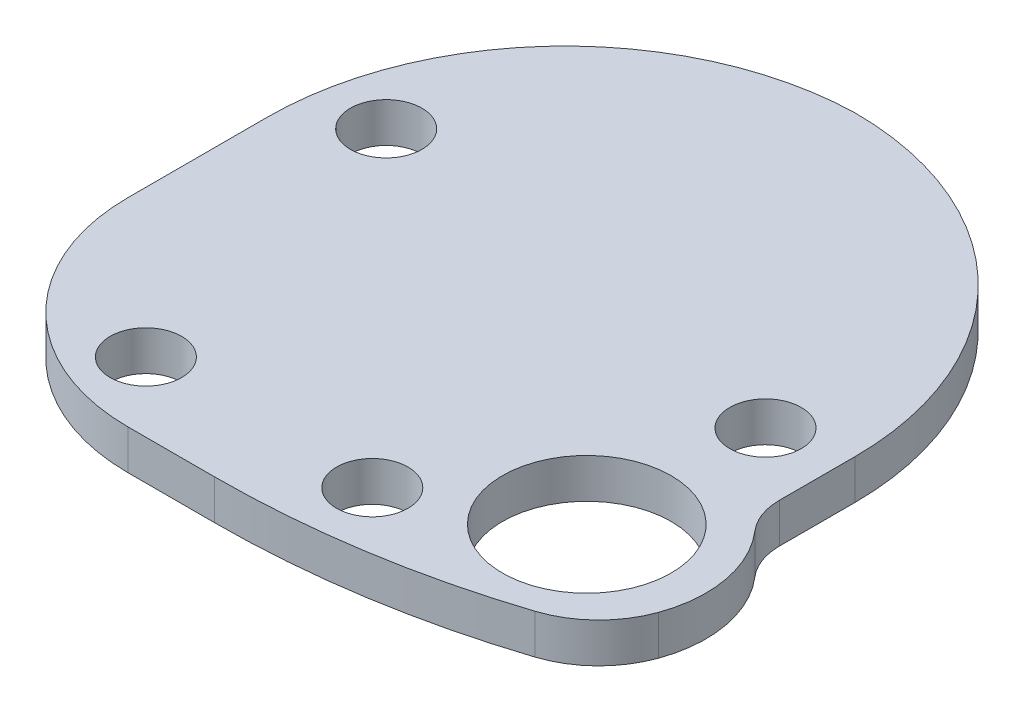
from build123d import *
from build123d.topology import SkipClean

# Parameters (mm, degrees)
SZKIC1_W                    = 15.6
SZKIC1_H                    = 25
SZKIC1_R                    = 1.8
SZKIC1_R_2                  = 1.5
DODANIE_WYCI_GNI_CIE1_DEPTH = 3
DODANIE_WYCI_GNI_CIE2_START = -10.5
SZKIC1_3_R                  = 1.8
SZKIC1_3_R_2                = 1.5
DODANIE_WYCI_GNI_CIE2_DEPTH = 10.5
ZAOKR_GLENIE1_R             = 10
ZAOKR_GLENIE6_R             = 45
ZAOKR_GLENIE7_R             = 5
ZAOKR_GLENIE8_R             = 15
ZAOKR_GLENIE10_R            = 0.2
SZKIC5_R                    = 4.25
WYTNIJ_WYCI_GNI_CIE3_DEPTH  = 1
ZAOKR_GLENIE11_R            = 1
ZAOKR_GLENIE12_START        = -10.5
ZAOKR_GLENIE12_DEPTH        = 13.5
ZAOKR_GLENIE13_R            = 3
DODANIE_WYCI_GNI_CIE3_START = 4.3
SZKIC8_R                    = 1.5
DODANIE_WYCI_GNI_CIE3_DEPTH = 4.3
WYTNIJ_WYCI_GNI_CIE5_DEPTH  = 129.982518339
SZKIC10_R                   = 3.3
WYTNIJ_WYCI_GNI_CIE6_DEPTH  = 1.6
SZKIC11_R                   = 1.8
DODANIE_WYCI_GNI_CIE4_DEPTH = 0.2
SZKIC12_R                   = 1.5
SZKIC12_R_2                 = 1.8
SZKIC12_R_3                 = 3.3
DODANIE_WYCI_GNI_CIE5_DEPTH = 0.2
ZAOKR_GLENIE14_R            = 3
SZKIC13_R                   = 1.5
SZKIC13_R_2                 = 4.25
DODANIE_WYCI_GNI_CIE6_DEPTH = 2
WYTNIJ_WYCI_GNI_CIE7_START  = -19.8
WYTNIJ_WYCI_GNI_CIE7_DEPTH  = 17.8
SZKIC15_R                   = 1.8
WYTNIJ_WYCI_GNI_CIE8_DEPTH  = 128.764040324


with BuildPart() as part:
    # Szkic1 → Dodanie-wyciągnięcie1 (new body)
    # profile 1 of 2: a face of its own
    with BuildSketch(Plane(origin=(0, 0, 0), x_dir=(1, 0, 0), z_dir=(0, 1, 0))):
        with Locations((4, -97.8)):
            Rectangle(SZKIC1_W, SZKIC1_H)
        with Locations(Location((4, -105.3, 0), (0, 0, 270))):
            Circle(SZKIC1_R, mode=Mode.SUBTRACT)
        with Locations(Location((4, -90.3, 0), (0, 0, 270))):
            Circle(SZKIC1_R, mode=Mode.SUBTRACT)
    # profile 2 of 2: a face of its own
    with BuildSketch(Plane(origin=(0, 0, 0), x_dir=(1, 0, 0), z_dir=(0, 1, 0))):
        with BuildLine():
            Line((11.8, -110.3), (-3.8, -110.3))
            Line((-3.8, -110.3), (-3.8, -85.3))
            Line((-3.8, -85.3), (-10.8, -85.3))
            Line((-10.8, -85.3), (-10.8, -105.356725294))
            ThreePointArc((-10.8, -105.356725294), (-13, -110), (-10.8, -114.643274706))
            Line((-10.8, -114.643274706), (-10.8, -117.3))
            Line((-10.8, -117.3), (18.8, -117.3))
            Line((18.8, -117.3), (18.8, -85.3))
            Line((18.8, -85.3), (11.8, -85.3))
            Line((11.8, -85.3), (11.8, -110.3))
        make_face()
        with Locations(Location((-7, -110, 0), (0, 0, 270))):
            Circle(SZKIC1_R, mode=Mode.SUBTRACT)
        with Locations(Location((0, -113.8, 0), (0, 0, 270))):
            Circle(SZKIC1_R_2, mode=Mode.SUBTRACT)
        with Locations(Location((11.4, -113.8, 0), (0, 0, 270))):
            Circle(SZKIC1_R_2, mode=Mode.SUBTRACT)
        with Locations(Location((-7.3, -101.3, 0), (0, 0, 270))):
            Circle(SZKIC1_R_2, mode=Mode.SUBTRACT)
        with Locations(Location((15.3, -97.8, 0), (0, 0, 270))):
            Circle(SZKIC1_R_2, mode=Mode.SUBTRACT)
    extrude(amount=DODANIE_WYCI_GNI_CIE1_DEPTH)

    # Szkic1<3> → Dodanie-wyciągnięcie2 (add)
    with BuildSketch(Plane(origin=(0, 0, 0), x_dir=(1, 0, 0), z_dir=(0, 1, 0)).offset(DODANIE_WYCI_GNI_CIE2_START)):
        with BuildLine():
            Line((11.8, -110.3), (-3.8, -110.3))
            Line((-3.8, -110.3), (-3.8, -85.3))
            Line((-3.8, -85.3), (-10.8, -85.3))
            Line((-10.8, -85.3), (-10.8, -105.356725294))
            ThreePointArc((-10.8, -105.356725294), (-13, -110), (-10.8, -114.643274706))
            Line((-10.8, -114.643274706), (-10.8, -117.3))
            Line((-10.8, -117.3), (18.8, -117.3))
            Line((18.8, -117.3), (18.8, -85.3))
            Line((18.8, -85.3), (11.8, -85.3))
            Line((11.8, -85.3), (11.8, -110.3))
        make_face()
        with Locations(Location((-7, -110, 0), (0, 0, 270))):
            Circle(SZKIC1_3_R, mode=Mode.SUBTRACT)
        with Locations(Location((0, -113.8, 0), (0, 0, 270))):
            Circle(SZKIC1_3_R_2, mode=Mode.SUBTRACT)
        with Locations(Location((11.4, -113.8, 0), (0, 0, 270))):
            Circle(SZKIC1_3_R_2, mode=Mode.SUBTRACT)
        with Locations(Location((-7.3, -101.3, 0), (0, 0, 270))):
            Circle(SZKIC1_3_R_2, mode=Mode.SUBTRACT)
        with Locations(Location((15.3, -97.8, 0), (0, 0, 270))):
            Circle(SZKIC1_3_R_2, mode=Mode.SUBTRACT)
    extrude(amount=DODANIE_WYCI_GNI_CIE2_DEPTH)

    # Zaokrąglenie1
    zaokr_glenie1_edges = [part.edges().sort_by_distance(p)[0] for p in [
        (18.8, -3.75, 117.3),
    ]]
    fillet(zaokr_glenie1_edges, radius=ZAOKR_GLENIE1_R)

    # Zaokrąglenie6
    # the kernel refuses this fillet: 45 mm, written as the material it takes off along each edge
    with BuildSketch(Plane(origin=(-10.8, 41.082729611, 117.3), x_dir=(1, 0, 0), z_dir=(0, -1, 0))) as zaokr_glenie6_piece_1:
        with BuildLine():
            CenterArc((15.233091844, -45), ZAOKR_GLENIE6_R, 90, 19.78631313)
            Line((0, -2.656725294), (0, 0))
            Line((0, 0), (15.233091844, 0))
        make_face()
    extrude(amount=89.665459221, mode=Mode.SUBTRACT)

    # Zaokrąglenie7
    zaokr_glenie7_edges = [part.edges().sort_by_distance(p)[0] for p in [
        (-10.8, -3.75, 114.643274706),
    ]]
    fillet(zaokr_glenie7_edges, radius=ZAOKR_GLENIE7_R)

    # Zaokrąglenie8
    zaokr_glenie8_edges = [part.edges().sort_by_distance(p)[0] for p in [
        (-10.8, -3.75, 85.3),
    ]]
    fillet(zaokr_glenie8_edges, radius=ZAOKR_GLENIE8_R)

    # Zaokrąglenie10
    zaokr_glenie10_edges = [part.edges().sort_by_distance(p)[0] for p in [
        (-3.8, -5.25, 110.3),
        (11.8, -5.25, 110.3),
    ]]
    fillet(zaokr_glenie10_edges, radius=ZAOKR_GLENIE10_R)

    # Szkic5 → Wytnij-wyciągnięcie3 (cut)
    with BuildSketch(Plane.XZ.offset(10.5)):
        with Locations((-7, 110)):
            Circle(SZKIC5_R)
    extrude(amount=-WYTNIJ_WYCI_GNI_CIE3_DEPTH, mode=Mode.SUBTRACT)

    # Zaokrąglenie11
    zaokr_glenie11_edges = [part.edges().sort_by_distance(p)[0] for p in [
        (-3.8, -10, 107.203126746),
        (-2.760601458, -10, 110.3),
    ]]
    fillet(zaokr_glenie11_edges, radius=ZAOKR_GLENIE11_R)

    # Zaokrąglenie12: read off the stored shape, not the designer's step
    # Zaokrąglenie12 outline → Zaokrąglenie12 (cut)
    with BuildSketch(Plane(origin=(0, 0, 0), x_dir=(1, 0, 0), z_dir=(0, 1, 0)).offset(ZAOKR_GLENIE12_START)):
        with BuildLine():
            Line((18.8, -85.3), (4.2, -85.3))
            ThreePointArc((4.2, -85.3), (14.54709263, -89.83044095), (18.8, -100.294665718))
            Line((18.8, -100.294665718), (18.8, -85.3))
        make_face()
    extrude(amount=ZAOKR_GLENIE12_DEPTH, mode=Mode.SUBTRACT)

    # Zaokrąglenie13
    zaokr_glenie13_edges = [part.edges().sort_by_distance(p)[0] for p in [
        (-3.8, -5.25, 87.61142246),
        (11.8, -5.25, 87.606088178),
    ]]
    fillet(zaokr_glenie13_edges, radius=ZAOKR_GLENIE13_R)

    # Szkic8 → Dodanie-wyciągnięcie3 (add)
    with SkipClean():  # the faces are left unmerged after this step: merging them gives an invalid solid
        with BuildSketch(Plane.XZ.offset(10.5).offset(DODANIE_WYCI_GNI_CIE3_START)):
            with BuildLine():
                Line((-3.8, 95.504168477), (-3.8, 105.233187648))
                ThreePointArc((-3.8, 105.233187648), (-4.261041569, 106.075520011), (-5.219047619, 106.141151905))
                ThreePointArc((-5.219047619, 106.141151905), (-10.837760193, 111.825950903), (-2.88235573, 111.052380952))
                ThreePointArc((-2.88235573, 111.052380952), (-2.52684194, 110.510183867), (-1.913498255, 110.3))
                Line((-1.913498255, 110.3), (11.6, 110.3))
                ThreePointArc((11.6, 110.3), (11.741421356, 110.241421356), (11.8, 110.1))
                Line((11.8, 110.1), (11.8, 95.498834195))
                ThreePointArc((11.8, 95.498834195), (14.187627564, 92.561999164), (17.55, 94.299876314))
                ThreePointArc((17.55, 94.299876314), (18.484175156, 97.23280354), (18.8, 100.294665718))
                Line((18.8, 100.294665718), (18.8, 107.3))
                ThreePointArc((18.8, 107.3), (15.871067812, 114.371067812), (8.8, 117.3))
                Line((8.8, 117.3), (4.433091844, 117.3))
                ThreePointArc((4.433091844, 117.3), (-2.614414646, 116.744714559), (-9.487993237, 115.092562323))
                ThreePointArc((-9.487993237, 115.092562323), (-11.423138006, 113.926168381), (-12.647236034, 112.026999056))
                ThreePointArc((-12.647236034, 112.026999056), (-12.782361558, 108.398658434), (-10.8, 105.356725294))
                Line((-10.8, 105.356725294), (-10.8, 100.3))
                ThreePointArc((-10.8, 100.3), (-10.484175156, 97.238137822), (-9.55, 94.305210596))
                ThreePointArc((-9.55, 94.305210596), (-6.187627564, 92.567333446), (-3.8, 95.504168477))
            make_face()
            with Locations(Location((15.3, 97.8, 0), (0, 0, 270))):
                Circle(SZKIC8_R, mode=Mode.SUBTRACT)
            with Locations(Location((11.4, 113.8, 0), (0, 0, 270))):
                Circle(SZKIC8_R, mode=Mode.SUBTRACT)
            with Locations(Location((-7.3, 101.3, 0), (0, 0, 270))):
                Circle(SZKIC8_R, mode=Mode.SUBTRACT)
            with Locations(Location((0, 113.8, 0), (0, 0, 270))):
                Circle(SZKIC8_R, mode=Mode.SUBTRACT)
        extrude(amount=-DODANIE_WYCI_GNI_CIE3_DEPTH)


with BuildPart() as body_2:
    # Lustro1: mirrored copy
    add(part.part.mirror(Plane(origin=(18.8, 3, 0), x_dir=(0, 0, 1), z_dir=(1, 0, 0))))

    # Szkic10 → Wytnij-wyciągnięcie6 (cut)
    with BuildSketch(Plane(origin=(0, 3, 0), x_dir=(1, 0, 0), z_dir=(0, 1, 0))):
        with Locations(Location((33.6, -105.3, 0), (0, 0, 270))):
            Circle(SZKIC10_R)
        with Locations(Location((33.6, -90.3, 0), (0, 0, 270))):
            Circle(SZKIC10_R)
    extrude(amount=-WYTNIJ_WYCI_GNI_CIE6_DEPTH, mode=Mode.SUBTRACT)

    # Szkic11 → Dodanie-wyciągnięcie4 (add)
    with BuildSketch(Plane(origin=(0, 1.4, 0), x_dir=(1, 0, 0), z_dir=(0, 1, 0))):
        with Locations(Location((33.6, -90.3, 0), (0, 0, 270))):
            Circle(SZKIC11_R)
        with Locations(Location((33.6, -105.3, 0), (0, 0, 270))):
            Circle(SZKIC11_R)
    extrude(amount=-DODANIE_WYCI_GNI_CIE4_DEPTH)

    # Szkic12 → Dodanie-wyciągnięcie5 (add)
    with BuildSketch(Plane(origin=(0, 3, 0), x_dir=(1, 0, 0), z_dir=(0, 1, 0))):
        with Locations(Location((44.9, -101.3, 0), (0, 0, 90))):
            Circle(SZKIC12_R)
        with Locations(Location((44.6, -110, 0), (0, 0, 90))):
            Circle(SZKIC12_R_2)
        with Locations(Location((37.6, -113.8, 0), (0, 0, 90))):
            Circle(SZKIC12_R)
        with Locations(Location((22.3, -97.8, 0), (0, 0, 90))):
            Circle(SZKIC12_R)
        with Locations(Location((26.2, -113.8, 0), (0, 0, 90))):
            Circle(SZKIC12_R)
        with Locations(Location((33.6, -90.3, 0), (0, 0, 270))):
            Circle(SZKIC12_R_3)
        with Locations(Location((33.6, -105.3, 0), (0, 0, 270))):
            Circle(SZKIC12_R_3)
    extrude(amount=-DODANIE_WYCI_GNI_CIE5_DEPTH)

    # Zaokrąglenie14
    zaokr_glenie14_edges = [body_2.edges().sort_by_distance(p)[0] for p in [
        (48.4, -3.75, 105.356725294),
    ]]
    fillet(zaokr_glenie14_edges, radius=ZAOKR_GLENIE14_R)

    # Szkic13 → Dodanie-wyciągnięcie6 (add)
    with BuildSketch(Plane.XZ.offset(14.8)):
        with BuildLine():
            Line((48.4, 100.3), (48.4, 104.104238811))
            ThreePointArc((48.4, 104.104238811), (48.589306135, 105.153047659), (49.133333333, 106.069492541))
            ThreePointArc((49.133333333, 106.069492541), (50.497793582, 108.897262104), (50.247236034, 112.026999056))
            ThreePointArc((50.247236034, 112.026999056), (49.023138006, 113.926168381), (47.087993237, 115.092562323))
            ThreePointArc((47.087993237, 115.092562323), (40.214414646, 116.744714559), (33.166908156, 117.3))
            Line((33.166908156, 117.3), (28.8, 117.3))
            ThreePointArc((28.8, 117.3), (21.728932188, 114.371067812), (18.8, 107.3))
            Line((18.8, 107.3), (18.8, 100.294665718))
            ThreePointArc((18.8, 100.294665718), (19.115824844, 97.23280354), (20.05, 94.299876314))
            ThreePointArc((20.05, 94.299876314), (25.41518823, 87.857023997), (33.4, 85.3))
            ThreePointArc((33.4, 85.3), (41.618216319, 87.751656662), (47.15, 94.305210596))
            ThreePointArc((47.15, 94.305210596), (48.084175156, 97.238137822), (48.4, 100.3))
        make_face()
        with Locations(Location((22.3, 97.8, 0), (0, 0, 270))):
            Circle(SZKIC13_R, mode=Mode.SUBTRACT)
        with Locations(Location((26.2, 113.8, 0), (0, 0, 270))):
            Circle(SZKIC13_R, mode=Mode.SUBTRACT)
        with Locations(Location((44.9, 101.3, 0), (0, 0, 270))):
            Circle(SZKIC13_R, mode=Mode.SUBTRACT)
        with Locations(Location((37.6, 113.8, 0), (0, 0, 270))):
            Circle(SZKIC13_R, mode=Mode.SUBTRACT)
        with Locations(Location((44.6, 110, 0), (0, 0, 270))):
            Circle(SZKIC13_R_2, mode=Mode.SUBTRACT)
    extrude(amount=DODANIE_WYCI_GNI_CIE6_DEPTH)

    # Szkic14 → Wytnij-wyciągnięcie7 (cut)
    with BuildSketch(Plane.XZ.offset(16.8).offset(WYTNIJ_WYCI_GNI_CIE7_START)):
        with BuildLine():
            Line((48.4, 100.3), (48.4, 104.104238811))
            ThreePointArc((48.4, 104.104238811), (48.589306135, 105.153047659), (49.133333333, 106.069492541))
            ThreePointArc((49.133333333, 106.069492541), (50.497793582, 108.897262104), (50.247236034, 112.026999056))
            ThreePointArc((50.247236034, 112.026999056), (49.023138006, 113.926168381), (47.087993237, 115.092562323))
            ThreePointArc((47.087993237, 115.092562323), (40.214414646, 116.744714559), (33.166908156, 117.3))
            Line((33.166908156, 117.3), (28.8, 117.3))
            ThreePointArc((28.8, 117.3), (21.728932188, 114.371067812), (18.8, 107.3))
            Line((18.8, 107.3), (18.8, 100.294665718))
            ThreePointArc((18.8, 100.294665718), (23.05290737, 89.83044095), (33.4, 85.3))
            ThreePointArc((33.4, 85.3), (44.006601718, 89.693398282), (48.4, 100.3))
        make_face()
    extrude(amount=WYTNIJ_WYCI_GNI_CIE7_DEPTH, mode=Mode.SUBTRACT)

    # Szkic15 → Wytnij-wyciągnięcie8 (cut, through all)
    with BuildSketch(Plane(origin=(0, -14.8, 0), x_dir=(1, 0, 0), z_dir=(0, 1, 0))):
        with Locations(Location((37.6, -113.8, 0), (0, 0, 270))):
            Circle(SZKIC15_R)
        with Locations(Location((26.2, -113.8, 0), (0, 0, 270))):
            Circle(SZKIC15_R)
        with Locations(Location((22.3, -97.8, 0), (0, 0, 270))):
            Circle(SZKIC15_R)
        with Locations(Location((44.9, -101.3, 0), (0, 0, 270))):
            Circle(SZKIC15_R)
    extrude(amount=-WYTNIJ_WYCI_GNI_CIE8_DEPTH, mode=Mode.SUBTRACT)


with BuildPart() as part_1:
    add(part.part)

    # Szkic9 → Wytnij-wyciągnięcie5 (cut, through all)
    with BuildSketch(Plane.XZ.offset(14.8)):
        with BuildLine():
            Line((18.8, 100.294665718), (18.8, 107.3))
            ThreePointArc((18.8, 107.3), (15.871067812, 114.371067812), (8.8, 117.3))
            Line((8.8, 117.3), (4.433091844, 117.3))
            ThreePointArc((4.433091844, 117.3), (-2.614414646, 116.744714559), (-9.487993237, 115.092562323))
            ThreePointArc((-9.487993237, 115.092562323), (-11.423138006, 113.926168381), (-12.647236034, 112.026999056))
            ThreePointArc((-12.647236034, 112.026999056), (-12.782361558, 108.398658434), (-10.8, 105.356725294))
            Line((-10.8, 105.356725294), (-10.8, 100.3))
            ThreePointArc((-10.8, 100.3), (-6.406601718, 89.693398282), (4.2, 85.3))
            ThreePointArc((4.2, 85.3), (14.54709263, 89.83044095), (18.8, 100.294665718))
        make_face()
    extrude(amount=-WYTNIJ_WYCI_GNI_CIE5_DEPTH, mode=Mode.SUBTRACT)


solid = body_2.part
